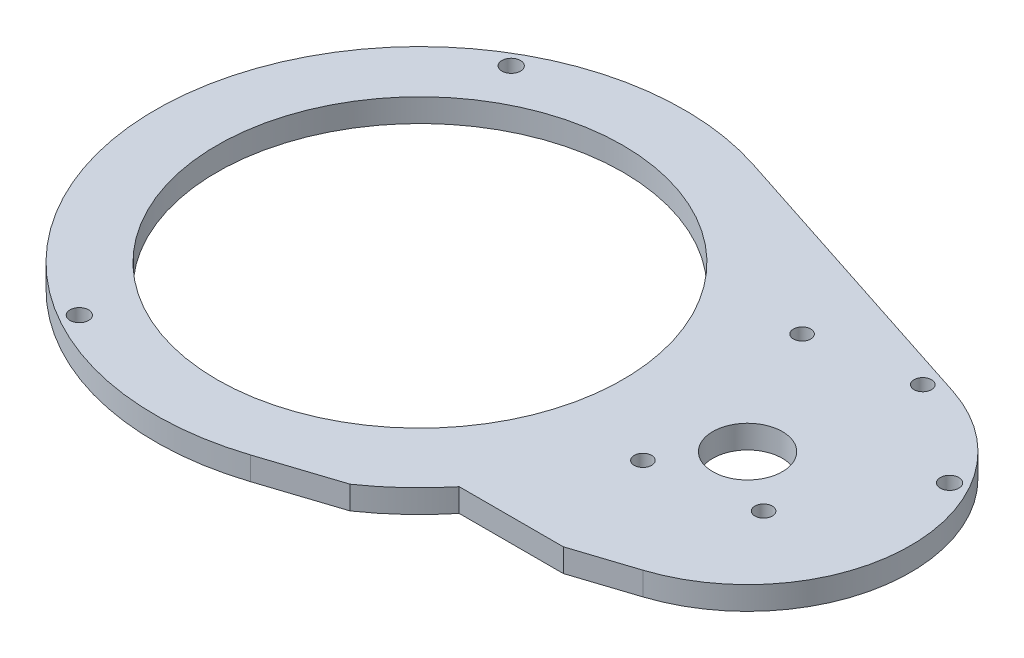
from build123d import *

# Parameters (mm, degrees)
BOSS_EXTRUDE1_DEPTH = 4
SKETCH2_R           = 4.5
SKETCH2_R_2         = 6
CUT_EXTRUDE1_DEPTH  = 10
SKETCH3_R           = 1.6
CUT_EXTRUDE2_DEPTH  = 10
SKETCH4_R           = 35
CUT_EXTRUDE3_DEPTH  = 10
SKETCH5_R           = 1.5
CUT_EXTRUDE4_DEPTH  = 10


with BuildPart() as part:
    # Sketch1 → Boss-Extrude1 (new body)
    with BuildSketch(Plane(origin=(0, 0, 0), x_dir=(1, 0, 0), z_dir=(0, 1, 0))):
        with BuildLine():
            ThreePointArc((14.123893805, 43.357532492), (-45.6, 0), (14.123893805, -43.357532492))
            Line((14.123893805, -43.357532492), (27.105327803, -39.128777194))
            ThreePointArc((27.105327803, -39.128777194), (32.307019566, -34.957352399), (36.874788135, -30.1))
            Line((36.874788135, -30.1), (54.821870135, -30.1))
            Line((54.821870135, -30.1), (65.203539823, -26.718128575))
            ThreePointArc((65.203539823, -26.718128575), (84.6, 0), (65.203539823, 26.718128575))
            Line((65.203539823, 26.718128575), (14.123893805, 43.357532492))
        make_face()
    extrude(amount=BOSS_EXTRUDE1_DEPTH)

    # Sketch2 → Cut-Extrude1 (cut)
    with BuildSketch(Plane(origin=(0, 4, 0), x_dir=(1, 0, 0), z_dir=(0, 1, 0))):
        Circle(SKETCH2_R)
        with Locations((56.5, 0)):
            Circle(SKETCH2_R_2)
    extrude(amount=-CUT_EXTRUDE1_DEPTH, mode=Mode.SUBTRACT)

    # Sketch3 → Cut-Extrude2 (cut)
    with BuildSketch(Plane(origin=(0, 4, 0), x_dir=(1, 0, 0), z_dir=(0, 1, 0))):
        with Locations((78.583647797, 12.75)):
            Circle(SKETCH3_R)
        with Locations((-21.5, 37.239092363)):
            Circle(SKETCH3_R)
        with Locations((-21.5, -37.239092363)):
            Circle(SKETCH3_R)
    extrude(amount=-CUT_EXTRUDE2_DEPTH, mode=Mode.SUBTRACT)

    # Sketch4 → Cut-Extrude3 (cut)
    with BuildSketch(Plane(origin=(0, 4, 0), x_dir=(1, 0, 0), z_dir=(0, 1, 0))):
        Circle(SKETCH4_R)
    extrude(amount=-CUT_EXTRUDE3_DEPTH, mode=Mode.SUBTRACT)

    # Sketch5 → Cut-Extrude4 (cut)
    with BuildSketch(Plane(origin=(0, 4, 0), x_dir=(1, 0, 0), z_dir=(0, 1, 0))):
        with Locations((48.781600067, -10.329892746)):
            Circle(SKETCH5_R)
        with Locations((66.758977017, -7.491950177)):
            Circle(SKETCH5_R)
        with Locations((61.613256974, 25.104392643)):
            Circle(SKETCH5_R)
        with Locations((43.635880025, 22.266450075)):
            Circle(SKETCH5_R)
    extrude(amount=-CUT_EXTRUDE4_DEPTH, mode=Mode.SUBTRACT)


solid = part.part
